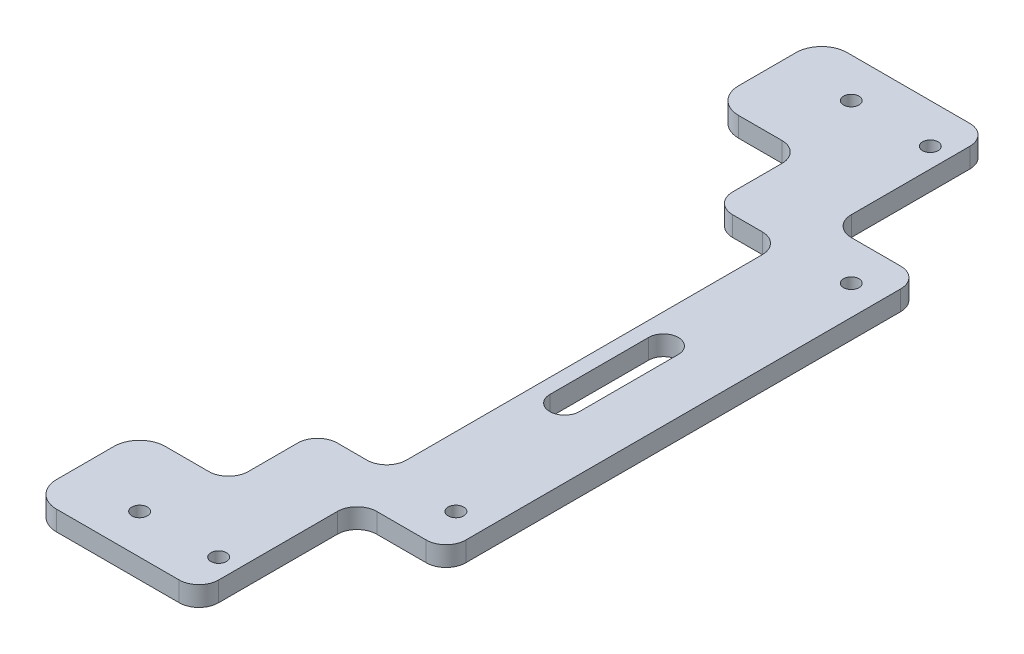
from build123d import *

# Parameters (mm, degrees)
SKETCH1_R           = 2.4892
BOSS_EXTRUDE1_DEPTH = 3.175
FILLET1_R           = 6.35
LPATTERN1_START     = -3.175
LPATTERN1_OUTLINE_R = 2.4892
LPATTERN1_DEPTH     = 6.35
SKETCH2_R           = 2.4892
SKETCH2_W           = 190.5
SKETCH2_H           = 254
CUT_EXTRUDE1_DEPTH  = 353.596579854
FILLET2_R           = 8.255


# Read off the part's stored shape, not the designer's step: LPattern1
with BuildPart() as part:
    # Sketch1 → Boss-Extrude1 (new, symmetric)
    with BuildSketch(Plane(origin=(0, 0, 0), x_dir=(1, 0, 0), z_dir=(0, 1, 0))):
        Polygon((0, 50.8), (0, 0), (215.9, 0), (215.9, 50.8), (244.475, 50.8), (244.475, 203.2), (215.9, 203.2), (215.9, 254), (0, 254), (0, 203.2), (-28.575, 203.2), (-28.575, 50.8), align=None)
        Polygon((12.7, 190.5), (12.7, 219.075), (190.5, 219.075), (190.5, 190.5), (212.725, 190.5), (212.725, 63.5), (190.5, 63.5), (190.5, 34.925), (12.7, 34.925), (12.7, 63.5), (-9.525, 63.5), (-9.525, 190.5), align=None, mode=Mode.SUBTRACT)
        with Locations(Location((209.55, 12.7, 0), (0, 0, 270))):
            Circle(SKETCH1_R, mode=Mode.SUBTRACT)
        with BuildLine():
            Line((227.0125, 142.875), (227.0125, 111.125))
            ThreePointArc((227.0125, 111.125), (222.25, 106.3625), (217.4875, 111.125))
            Line((217.4875, 111.125), (217.4875, 142.875))
            ThreePointArc((217.4875, 142.875), (222.25, 147.6375), (227.0125, 142.875))
        make_face(mode=Mode.SUBTRACT)
        with BuildLine():
            ThreePointArc((-14.2875, 111.125), (-19.05, 106.3625), (-23.8125, 111.125))
            Line((-23.8125, 111.125), (-23.8125, 142.875))
            ThreePointArc((-23.8125, 142.875), (-19.05, 147.6375), (-14.2875, 142.875))
            Line((-14.2875, 142.875), (-14.2875, 111.125))
        make_face(mode=Mode.SUBTRACT)
        with Locations(Location((209.55, 241.3, 0), (0, 0, 270))):
            Circle(SKETCH1_R, mode=Mode.SUBTRACT)
    extrude(amount=BOSS_EXTRUDE1_DEPTH, both=True)

    # Fillet1
    fillet1_edges = [part.edges().sort_by_distance(p)[0] for p in [
        (0, 0, 0),
        (0, 0, -50.8),
        (-28.575, 0, -50.8),
        (-28.575, 0, -203.2),
        (0, 0, -203.2),
        (0, 0, -254),
        (215.9, 0, -254),
        (215.9, 0, -203.2),
        (244.475, 0, -203.2),
        (244.475, 0, -50.8),
        (215.9, 0, -50.8),
        (215.9, 0, 0),
        (212.725, 0, -190.5),
        (190.5, 0, -190.5),
        (190.5, 0, -219.075),
        (12.7, 0, -219.075),
        (12.7, 0, -190.5),
        (-9.525, 0, -190.5),
        (-9.525, 0, -63.5),
        (12.7, 0, -63.5),
        (12.7, 0, -34.925),
        (190.5, 0, -34.925),
        (190.5, 0, -63.5),
        (212.725, 0, -63.5),
    ]]
    fillet(fillet1_edges, radius=FILLET1_R)

    # LPattern1 outline → LPattern1 (cut)
    with BuildSketch(Plane(origin=(0, 0, 0), x_dir=(1, 0, 0), z_dir=(0, 1, 0)).offset(LPATTERN1_START)):
        with Locations((31.75, 12.7)):
            Circle(LPATTERN1_OUTLINE_R)
        with Locations((31.75, 241.3)):
            Circle(LPATTERN1_OUTLINE_R)
        with Locations((57.15, 12.7)):
            Circle(LPATTERN1_OUTLINE_R)
        with Locations((57.15, 241.3)):
            Circle(LPATTERN1_OUTLINE_R)
        with Locations((82.55, 12.7)):
            Circle(LPATTERN1_OUTLINE_R)
        with Locations((82.55, 241.3)):
            Circle(LPATTERN1_OUTLINE_R)
        with Locations((107.95, 12.7)):
            Circle(LPATTERN1_OUTLINE_R)
        with Locations((107.95, 241.3)):
            Circle(LPATTERN1_OUTLINE_R)
        with Locations((133.35, 12.7)):
            Circle(LPATTERN1_OUTLINE_R)
        with Locations((133.35, 241.3)):
            Circle(LPATTERN1_OUTLINE_R)
        with Locations((158.75, 12.7)):
            Circle(LPATTERN1_OUTLINE_R)
        with Locations((158.75, 241.3)):
            Circle(LPATTERN1_OUTLINE_R)
        with Locations((184.15, 12.7)):
            Circle(LPATTERN1_OUTLINE_R)
        with Locations((184.15, 241.3)):
            Circle(LPATTERN1_OUTLINE_R)
    extrude(amount=LPATTERN1_DEPTH, mode=Mode.SUBTRACT)

    # Sketch2 → Cut-Extrude1 (cut, through all)
    with BuildSketch(Plane(origin=(0, 3.175, 0), x_dir=(1, 0, 0), z_dir=(0, 1, 0))):
        with Locations(Location((234.95, 190.5, 0), (0, 0, 270))):
            Circle(SKETCH2_R)
        with Locations(Location((234.95, 63.5, 0), (0, 0, 270))):
            Circle(SKETCH2_R)
        with Locations((66.675, 127)):
            Rectangle(SKETCH2_W, SKETCH2_H)
    extrude(amount=-CUT_EXTRUDE1_DEPTH, mode=Mode.SUBTRACT)

    # Fillet2
    fillet2_edges = [part.edges().sort_by_distance(p)[0] for p in [
        (161.925, 0, -34.925),
        (161.925, 0, -219.075),
        (161.925, 0, -254),
        (161.925, 0, 0),
    ]]
    fillet(fillet2_edges, radius=FILLET2_R)


solid = part.part
